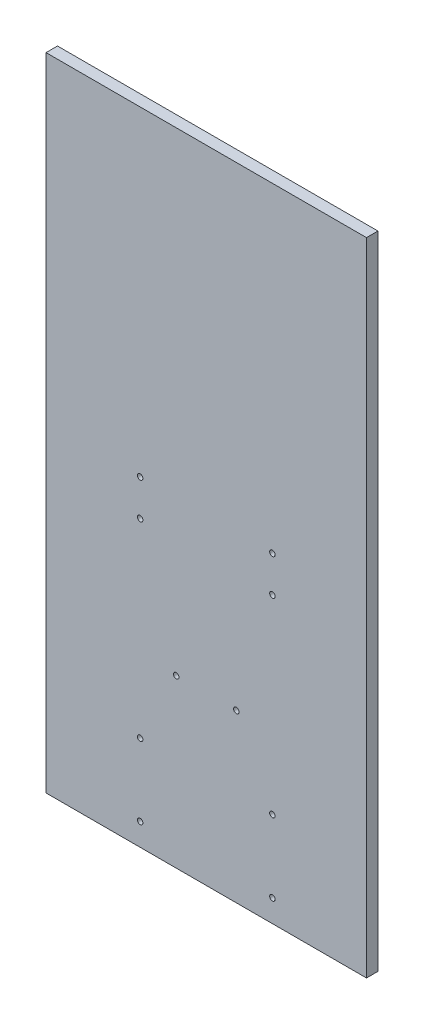
from build123d import *

# Parameters (mm, degrees)
SKETCH1_W                        = 533.146
SKETCH1_H                        = 1066.799994849
BOSS_EXTRUDE1_DEPTH              = 19.05
F_23_64_0_35938_DIAMETER_HOLE1_D = 9.128252


with BuildPart() as part:
    # Sketch1 → Boss-Extrude1 (new body)
    with BuildSketch(Plane.XY):
        with Locations((0, 6469.379997497)):
            Rectangle(SKETCH1_W, SKETCH1_H)
    extrude(amount=-BOSS_EXTRUDE1_DEPTH)

    # 23/64 (0.35938) Diameter Hole1 (through all)
    with Locations(Plane(origin=(0, 0, -19.05), x_dir=(-1, 0, 0), z_dir=(0, 0, -1))):
        with Locations((110, 5973.262000072), (110, 6093.262000072), (-110, 6093.262000072), (-110, 5973.262000072), (-50, 6213.262000072), (50, 6213.262000072), (-110, 6409.662000072), (-110, 6469.662000072), (110, 6409.662000072), (110, 6469.662000072)):
            Hole(F_23_64_0_35938_DIAMETER_HOLE1_D / 2)


solid = part.part
